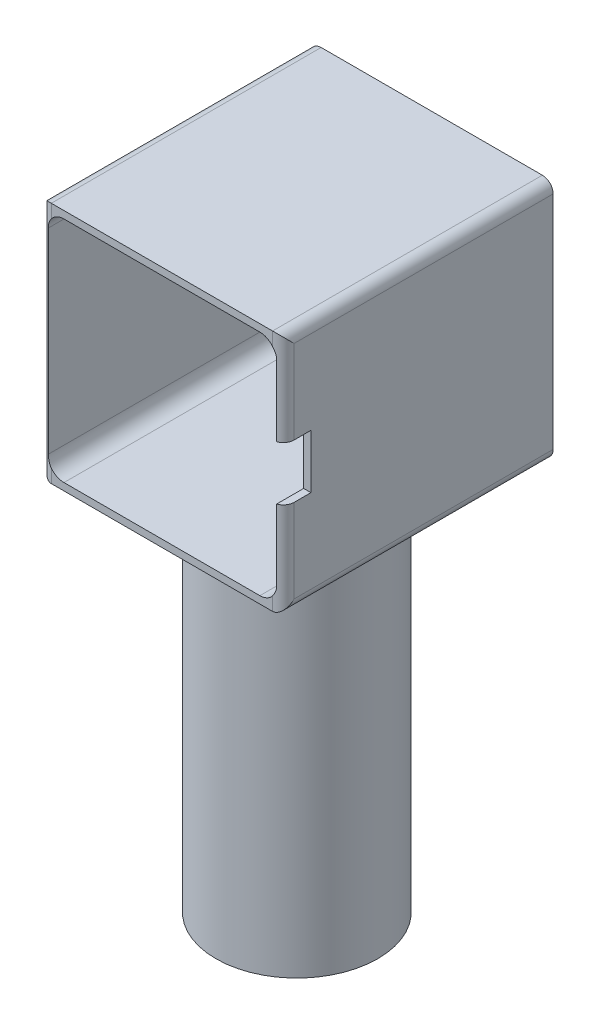
from build123d import *

# Parameters (mm, degrees)
SKETCH1_W               = 45
SKETCH1_H               = 45
BOSS_EXTRUDE1_DEPTH     = 50
SKETCH2_W               = 42.3
SKETCH2_H               = 42.3
CUT_EXTRUDE1_DEPTH      = 46
CUT_EXTRUDE2_DEPTH      = 56.932995629
CUT_EXTRUDE2_DEPTH_BACK = 56.932995629
SKETCH3_R               = 1.5
SKETCH3_R_2             = 2.75
SKETCH4_R               = 15
BOSS_EXTRUDE2_DEPTH     = 71
FILLET1_R               = 2
FILLET2_R               = 5
FILLET3_R               = 3
SKETCH7_W               = 5
SKETCH7_H               = 10
CUT_EXTRUDE3_DEPTH      = 10


with BuildPart() as part:
    # Sketch1 → Boss-Extrude1 (new body)
    with BuildSketch(Plane.XY):
        Rectangle(SKETCH1_W, SKETCH1_H)
    extrude(amount=BOSS_EXTRUDE1_DEPTH)

    # Sketch2 → Cut-Extrude1 (cut)
    with BuildSketch(Plane.XY.offset(50)):
        Rectangle(SKETCH2_W, SKETCH2_H)
    extrude(amount=-CUT_EXTRUDE1_DEPTH, mode=Mode.SUBTRACT)

    # Sketch3 → Cut-Extrude2 (cut, two sides: drawn at the far end of the back side and taken through both)
    with BuildSketch(Plane.XY.offset(4).offset(-CUT_EXTRUDE2_DEPTH_BACK)):
        with Locations((-15.499780644, 15.499780644)):
            Circle(SKETCH3_R)
        with Locations((15.499780644, 15.499780644)):
            Circle(SKETCH3_R)
        with Locations((15.499780644, -15.499780644)):
            Circle(SKETCH3_R)
        with Locations((-15.499780644, -15.499780644)):
            Circle(SKETCH3_R)
        Circle(SKETCH3_R_2)
    extrude(amount=CUT_EXTRUDE2_DEPTH + CUT_EXTRUDE2_DEPTH_BACK, mode=Mode.SUBTRACT)

    # Sketch4 → Boss-Extrude2 (add)
    with BuildSketch(Plane.XZ.offset(22.5)):
        with Locations(Location((0, 25, 0), (0, 0, 270))):
            Circle(SKETCH4_R)
    extrude(amount=BOSS_EXTRUDE2_DEPTH)

    # Fillet1
    # the kernel refuses this fillet: 2 mm, written as the material it takes off along each edge
    with BuildSketch(Plane(origin=(-22.5, -27.5, 50), x_dir=(0, 0, -1), z_dir=(0, 1, 0)), Plane(origin=(22.5, 27.5, 50), x_dir=(0, 0, -1), z_dir=(0, -1, 0))) as fillet1_piece_1:
        with BuildLine():
            CenterArc((FILLET1_R, -FILLET1_R), FILLET1_R, 90, 90)
            Line((0, -FILLET1_R), (0, 0))
            Line((0, 0), (FILLET1_R, 0))
        make_face()
    extrude(amount=55, mode=Mode.SUBTRACT)
    with BuildSketch(Plane(origin=(22.5, -22.5, -5), x_dir=(0, 1, 0), z_dir=(0, 0, 1)), Plane(origin=(22.5, 22.5, -5), x_dir=(-1, 0, 0), z_dir=(0, 0, 1))) as fillet1_piece_2:
        with BuildLine():
            CenterArc((FILLET1_R, FILLET1_R), FILLET1_R, 180, 90)
            Line((0, FILLET1_R), (0, 0))
            Line((0, 0), (FILLET1_R, 0))
        make_face()
    extrude(amount=60, mode=Mode.SUBTRACT)
    with BuildSketch(Plane(origin=(-22.5, -22.5, -5), x_dir=(0, 1, 0), z_dir=(0, 0, 1)), Plane(origin=(-22.5, 22.5, -5), x_dir=(1, 0, 0), z_dir=(0, 0, 1))) as fillet1_piece_3:
        with BuildLine():
            CenterArc((FILLET1_R, -FILLET1_R), FILLET1_R, 90, 90)
            Line((0, -FILLET1_R), (0, 0))
            Line((0, 0), (FILLET1_R, 0))
        make_face()
    extrude(amount=60, mode=Mode.SUBTRACT)

    # Fillet2
    fillet2_edges = [part.edges().sort_by_distance(p)[0] for p in [
        (0, -22.5, 40),
    ]]
    fillet(fillet2_edges, radius=FILLET2_R)

    # Fillet3
    fillet3_edges = [part.edges().sort_by_distance(p)[0] for p in [
        (-21.15, -21.15, 26.945714016),
        (21.15, 21.15, 26.945714016),
        (-21.15, 21.15, 26.945714016),
        (21.15, -21.15, 26.945714016),
    ]]
    fillet(fillet3_edges, radius=FILLET3_R)

    # Sketch7 → Cut-Extrude3 (cut)
    with BuildSketch(Plane(origin=(22.5, 0, 0), x_dir=(0, 0, -1), z_dir=(1, 0, 0))):
        with Locations((-47.391428032, 0)):
            Rectangle(SKETCH7_W, SKETCH7_H)
    extrude(amount=-CUT_EXTRUDE3_DEPTH, mode=Mode.SUBTRACT)


solid = part.part
